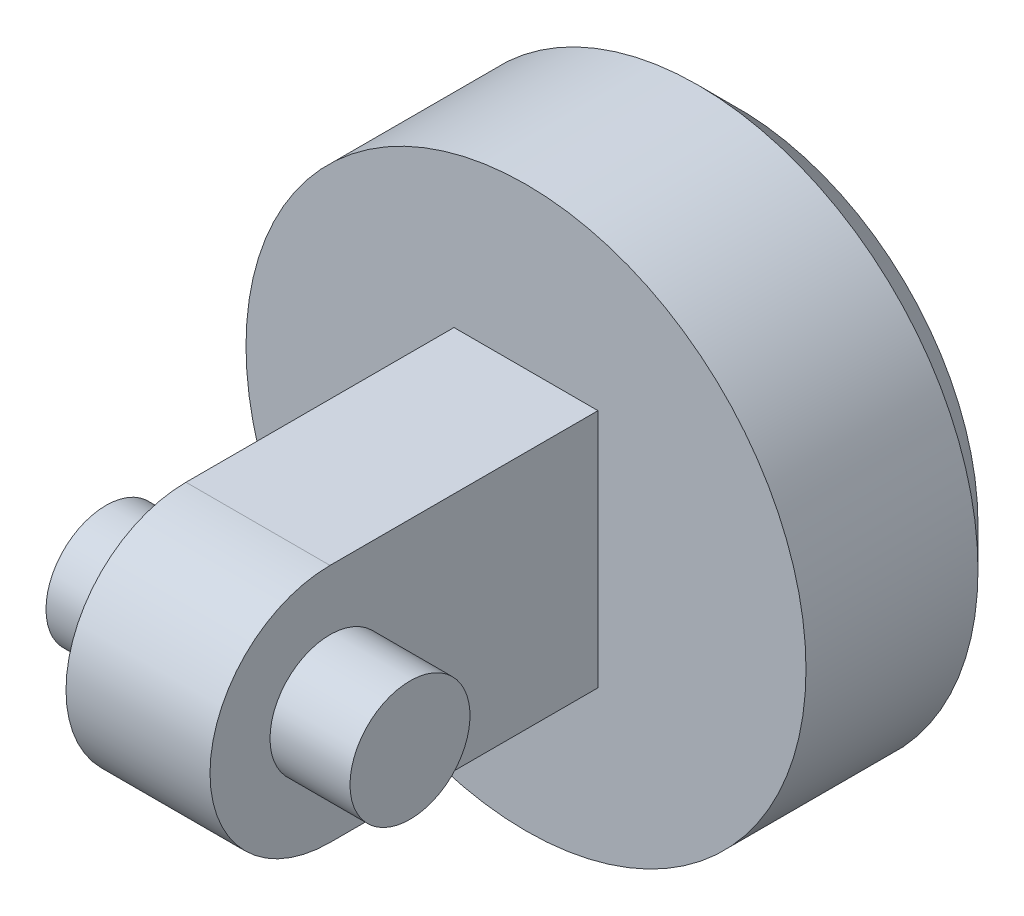
from build123d import *

# Parameters (mm, degrees)
SKETCH_1_R          = 7
EXTRUDE_1_DEPTH     = 5.3
SKETCH_2_W          = 3.6
SKETCH_2_H          = 6
EXTRUDE_2_DEPTH     = 9.7
CUT_EXTRUDE_START   = -3.6
CUT_EXTRUDE_1_DEPTH = 3.6
CHAMFER_1_SIZE      = 1
SKETCH_4_R          = 1.5
EXTRUDE_3_DEPTH     = 2


# Read off the part's stored shape, not the designer's step: 切除-拉伸1
with BuildPart() as part:
    # 草图1 → 凸台-拉伸1 (new body)
    with BuildSketch(Plane.XY):
        Circle(SKETCH_1_R)
    extrude(amount=EXTRUDE_1_DEPTH)

    # 草图2 → 凸台-拉伸2 (add)
    with BuildSketch(Plane.XY.offset(5.3)):
        Rectangle(SKETCH_2_W, SKETCH_2_H)
    extrude(amount=EXTRUDE_2_DEPTH)

    # 切除-拉伸1 outline → 切除-拉伸1 (cut)
    with BuildSketch(Plane.ZY.offset(1.8).offset(CUT_EXTRUDE_START)):
        with BuildLine():
            Line((15, 3), (12, 3))
            ThreePointArc((12, 3), (14.121320344, 2.121320344), (15, 0))
            Line((15, 0), (15, 3))
        make_face()
        with BuildLine():
            Line((15, -3), (15, 0))
            ThreePointArc((15, 0), (14.121320344, -2.121320344), (12, -3))
            Line((12, -3), (15, -3))
        make_face()
    extrude(amount=CUT_EXTRUDE_1_DEPTH, mode=Mode.SUBTRACT)

    # 倒角1
    chamfer_1_edges = [part.edges().sort_by_distance(p)[0] for p in [
        (-7, 0, 0),
    ]]
    chamfer(chamfer_1_edges, length=CHAMFER_1_SIZE)

    # 草图4 → 凸台-拉伸3 (add)
    with BuildSketch(Plane.ZY.offset(1.8)):
        with Locations(Location((12, 0, 0), (0, 0, 180))):
            Circle(SKETCH_4_R)
    extrude_3 = extrude(amount=EXTRUDE_3_DEPTH)

    # 镜向1: 凸台-拉伸3 across plane
    add(extrude_3.mirror(Plane(origin=(0, 0, 0), x_dir=(0, 0, 1), z_dir=(1, 0, 0))))


solid = part.part
